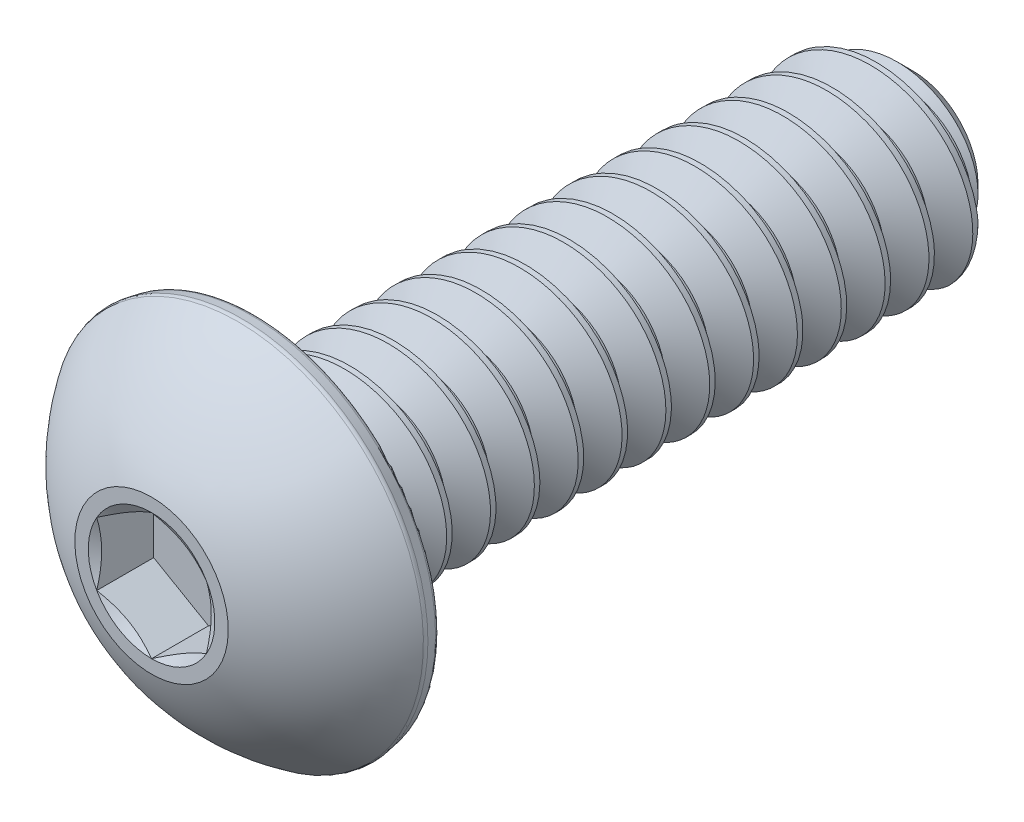
from build123d import *

# Parameters (mm, degrees)
CUT_EXTRUDE1_DEPTH = 0.82423
FILLET1_R          = 0.07493
CUT_SWEEP1_PITCH   = 0.635


# Read off the part's stored shape, not the designer's step: Split1
with BuildPart() as part:
    # Sketch3 → Revolve1 (revolve)
    with BuildSketch(Plane(origin=(0, 0, 0), x_dir=(0, 0, -1), z_dir=(1, 0, 0)), mode=Mode.PRIVATE) as revolve1_sk:
        with BuildLine():
            Line((-5.5118, 0), (-5.5118, 1.11125))
            ThreePointArc((-5.5118, 1.11125), (-5.004381418, 2.011660958), (-4.23799, 2.7051))
            Line((-4.23799, 2.7051), (-4.0132, 2.665463458))
            Line((-4.0132, 2.665463458), (-4.0132, 1.4224))
            Line((-4.0132, 1.4224), (5.03555, 1.4224))
            Line((5.03555, 1.4224), (5.5118, 0.94615))
            Line((5.5118, 0.94615), (5.5118, 0))
            Line((5.5118, 0), (-5.5118, 0))
        make_face()
    revolve(revolve1_sk.sketch.rotate(Axis((0, 0, 5.5118), (0, 0, -1)), 90), axis=Axis((0, 0, 5.5118), (0, 0, -1)))

    # Sketch4 → Cut-Extrude1 (cut)
    with BuildSketch(Plane.XY.offset(5.5118)):
        Polygon((-0.79375, -0.458271776), (0, -0.916543552), (0.79375, -0.458271776), (0.79375, 0.458271776), (0, 0.916543552), (-0.79375, 0.458271776), align=None)
    extrude(amount=-CUT_EXTRUDE1_DEPTH, mode=Mode.SUBTRACT)

    # Cut-Extrude2 cone 1 section (through the dimple's axis) → Cut-Extrude2 (revolve, cut)
    with BuildSketch(Plane(origin=(0, 0, 5.5118), x_dir=(0, -1, 0), z_dir=(1, 0, 0))):
        Polygon((0, 0), (0.916543552, 0), (0, 0.529166667), align=None)
    revolve(axis=Axis((0, 0, 5.5118), (0, 0, -1)), mode=Mode.SUBTRACT)

    # Fillet1
    fillet1_edges = [part.edges().sort_by_distance(p)[0] for p in [
        (-2.665463458, 0, 4.0132),
        (-2.7051, 0, 4.23799),
    ]]
    fillet(fillet1_edges, radius=FILLET1_R)


with BuildPart() as body_2:
    # Split1: the piece on the far side of the plane
    add(part.part)
    split(bisect_by=Plane.XY.offset(4.0132), keep=Keep.BOTTOM)

    # Cut-Sweep1: the profile of Sketch7 screwed along a right-hand helix of 16 turns, 6 arcs to a turn; built about Z, then put on its axis
    cut_sweep1_z = Axis((0, 0, 0), (0, 0, 1))
    cut_sweep1_corners = [(1.456770383, 0, 0.01984375), (1.456770383, 0, -0.57546875), (1.009955401, 0, -0.3175), (1.009955401, 0, -0.238125)]
    with BuildLine(mode=Mode.PRIVATE) as cut_sweep1_profile:
        Line(cut_sweep1_corners[0], cut_sweep1_corners[1])
        Line(cut_sweep1_corners[1], cut_sweep1_corners[2])
        Line(cut_sweep1_corners[2], cut_sweep1_corners[3])
        Line(cut_sweep1_corners[3], cut_sweep1_corners[0])
    cut_sweep1_cap = Face(cut_sweep1_profile.wire())
    cut_sweep1_turn_angles = [0, 30, 60, 90, 120, 150, 180, 210, 240, 270, 300, 330, 360]
    cut_sweep1_turn_weights = [1, 0.8660254037844387, 1, 0.8660254037844387, 1, 0.8660254037844387, 1, 0.8660254037844387, 1, 0.8660254037844387, 1, 0.8660254037844387, 1]
    cut_sweep1_turn_rails = [Edge.make_bspline([Vector(p[0], p[1], 0).rotate(cut_sweep1_z, cut_sweep1_turn_angles[k]) / cut_sweep1_turn_weights[k] + Vector(0, 0, p[2] + CUT_SWEEP1_PITCH * cut_sweep1_turn_angles[k] / 360) for k in range(13)], [0, 0, 0, 1, 1, 2, 2, 3, 3, 4, 4, 5, 5, 6, 6, 6], 2, cut_sweep1_turn_weights) for p in cut_sweep1_corners]
    cut_sweep1_turn_sides = [Face.make_surface_from_curves(cut_sweep1_turn_rails[p[0]], cut_sweep1_turn_rails[p[1]]) for p in [(0, 1), (1, 2), (2, 3), (3, 0)]]
    cut_sweep1 = Plane(origin=(0, 0, -5.5118), x_dir=(0, 1, 0), z_dir=(0, 0, 1)) * Solid(Shell([*[p.moved(Location((0, 0, CUT_SWEEP1_PITCH * i))) for i in range(16) for p in cut_sweep1_turn_sides], cut_sweep1_cap, cut_sweep1_cap.rotate(cut_sweep1_z, 5760).moved(Location((0, 0, CUT_SWEEP1_PITCH * 5760 / 360)))]))
    add(cut_sweep1, mode=Mode.SUBTRACT)


with BuildPart() as part_1:
    add(part.part)

    # Split1
    split(bisect_by=Plane.XY.offset(4.0132), keep=Keep.TOP)

    add(body_2.part)  # Boss-Extrude1 merges body 2
    # Boss-Extrude1 cone 1 section (through the dimple's axis) → Boss-Extrude1 (revolve)
    with BuildSketch(Plane(origin=(0, 0, 4.0132), x_dir=(0, -1, 0), z_dir=(1, 0, 0))):
        Polygon((0, 0), (1.491140766, 0), (0, 1.491140766), align=None)
    revolve(axis=Axis((0, 0, 4.0132), (0, 0, -1)))


solid = part_1.part
